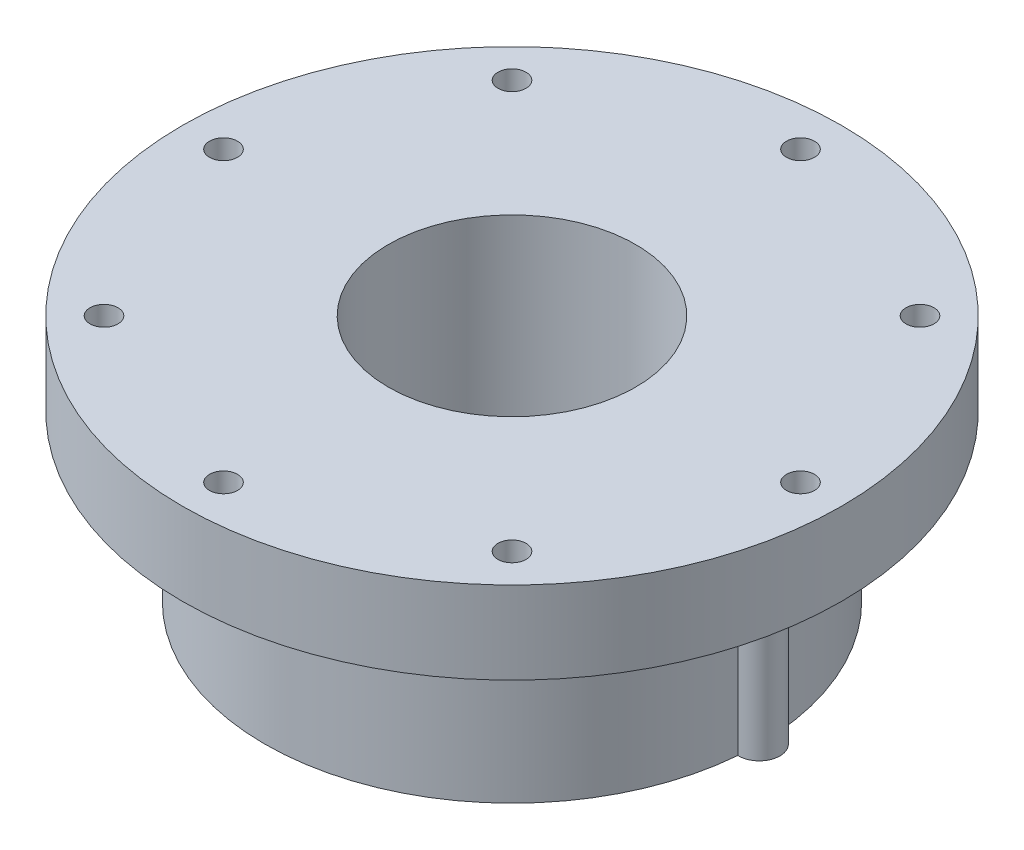
from build123d import *

# Parameters (mm, degrees)
CROQUIS1_R                                     = 15
SALIENTE_EXTRUIR1_DEPTH                        = 10
CROQUIS2_R                                     = 40
CROQUIS2_R_2                                   = 15
SALIENTE_EXTRUIR2_DEPTH                        = 10
REFRENTADO_START                               = 10
REFRENTADO_PARA_TORNILLO_CON_CABEZA_2_R        = 3.5
REFRENTADO_PARA_TORNILLO_CON_CABEZA_TRON_DEPTH = 2.4
REFRENTADO_START_2                             = 12.4
REFRENTADO_PARA_TORNILLO_CON_CABEZA_3_OU_R     = 1.7
REFRENTADO_PARA_TORNILLO_CON_CABEZA_3_DEPTH    = 7.6


# Read off the part's stored shape, not the designer's step: Refrentado para tornillo con cabeza troncocónica de M31
with BuildPart() as part:
    # Croquis1 → Saliente-Extruir1 (new, symmetric)
    with BuildSketch(Plane(origin=(0, 0, 0), x_dir=(1, 0, 0), z_dir=(0, 1, 0))):
        with BuildLine():
            ThreePointArc((29.895833333, 2.497828918), (-30, 0), (29.895833333, -2.497828918))
            ThreePointArc((29.895833333, -2.497828918), (32.5, 0), (29.895833333, 2.497828918))
        make_face()
        with Locations(Location((0, 0, 0), (0, 0, 270))):
            Circle(CROQUIS1_R, mode=Mode.SUBTRACT)
    extrude(amount=SALIENTE_EXTRUIR1_DEPTH, both=True)

    # Croquis2 → Saliente-Extruir2 (add)
    with BuildSketch(Plane(origin=(0, 10, 0), x_dir=(1, 0, 0), z_dir=(0, 1, 0))):
        with Locations(Location((0, 0, 0), (0, 0, 270))):
            Circle(CROQUIS2_R)
        with Locations(Location((0, 0, 0), (0, 0, 270))):
            Circle(CROQUIS2_R_2, mode=Mode.SUBTRACT)
    extrude(amount=SALIENTE_EXTRUIR2_DEPTH)

    # Refrentado para tornillo con cabeza  2 → Refrentado para tornillo con cabeza troncocónica de M31 (cut)
    with BuildSketch(Plane(origin=(0, 0, 0), x_dir=(1, 0, 0), z_dir=(0, 1, 0)).offset(REFRENTADO_START)):
        with Locations((-24.748737342, -24.748737342)):
            Circle(REFRENTADO_PARA_TORNILLO_CON_CABEZA_2_R)
        with Locations((-35, 0)):
            Circle(REFRENTADO_PARA_TORNILLO_CON_CABEZA_2_R)
        with Locations((-24.748737342, 24.748737342)):
            Circle(REFRENTADO_PARA_TORNILLO_CON_CABEZA_2_R)
        with Locations((0, 35)):
            Circle(REFRENTADO_PARA_TORNILLO_CON_CABEZA_2_R)
        with Locations((24.748737342, 24.748737342)):
            Circle(REFRENTADO_PARA_TORNILLO_CON_CABEZA_2_R)
        with Locations((35, 0)):
            Circle(REFRENTADO_PARA_TORNILLO_CON_CABEZA_2_R)
        with Locations((24.748737342, -24.748737342)):
            Circle(REFRENTADO_PARA_TORNILLO_CON_CABEZA_2_R)
        with Locations((0, -35)):
            Circle(REFRENTADO_PARA_TORNILLO_CON_CABEZA_2_R)
    extrude(amount=REFRENTADO_PARA_TORNILLO_CON_CABEZA_TRON_DEPTH, mode=Mode.SUBTRACT)

    # Refrentado para tornillo con cabeza 3 ou → Refrentado para tornillo con cabeza  3 (cut)
    with BuildSketch(Plane(origin=(0, 0, 0), x_dir=(1, 0, 0), z_dir=(0, 1, 0)).offset(REFRENTADO_START_2)):
        with Locations((-24.748737342, -24.748737342)):
            Circle(REFRENTADO_PARA_TORNILLO_CON_CABEZA_3_OU_R)
        with Locations((-35, 0)):
            Circle(REFRENTADO_PARA_TORNILLO_CON_CABEZA_3_OU_R)
        with Locations((-24.748737342, 24.748737342)):
            Circle(REFRENTADO_PARA_TORNILLO_CON_CABEZA_3_OU_R)
        with Locations((0, 35)):
            Circle(REFRENTADO_PARA_TORNILLO_CON_CABEZA_3_OU_R)
        with Locations((24.748737342, 24.748737342)):
            Circle(REFRENTADO_PARA_TORNILLO_CON_CABEZA_3_OU_R)
        with Locations((35, 0)):
            Circle(REFRENTADO_PARA_TORNILLO_CON_CABEZA_3_OU_R)
        with Locations((24.748737342, -24.748737342)):
            Circle(REFRENTADO_PARA_TORNILLO_CON_CABEZA_3_OU_R)
        with Locations((0, -35)):
            Circle(REFRENTADO_PARA_TORNILLO_CON_CABEZA_3_OU_R)
    extrude(amount=REFRENTADO_PARA_TORNILLO_CON_CABEZA_3_DEPTH, mode=Mode.SUBTRACT)


solid = part.part
